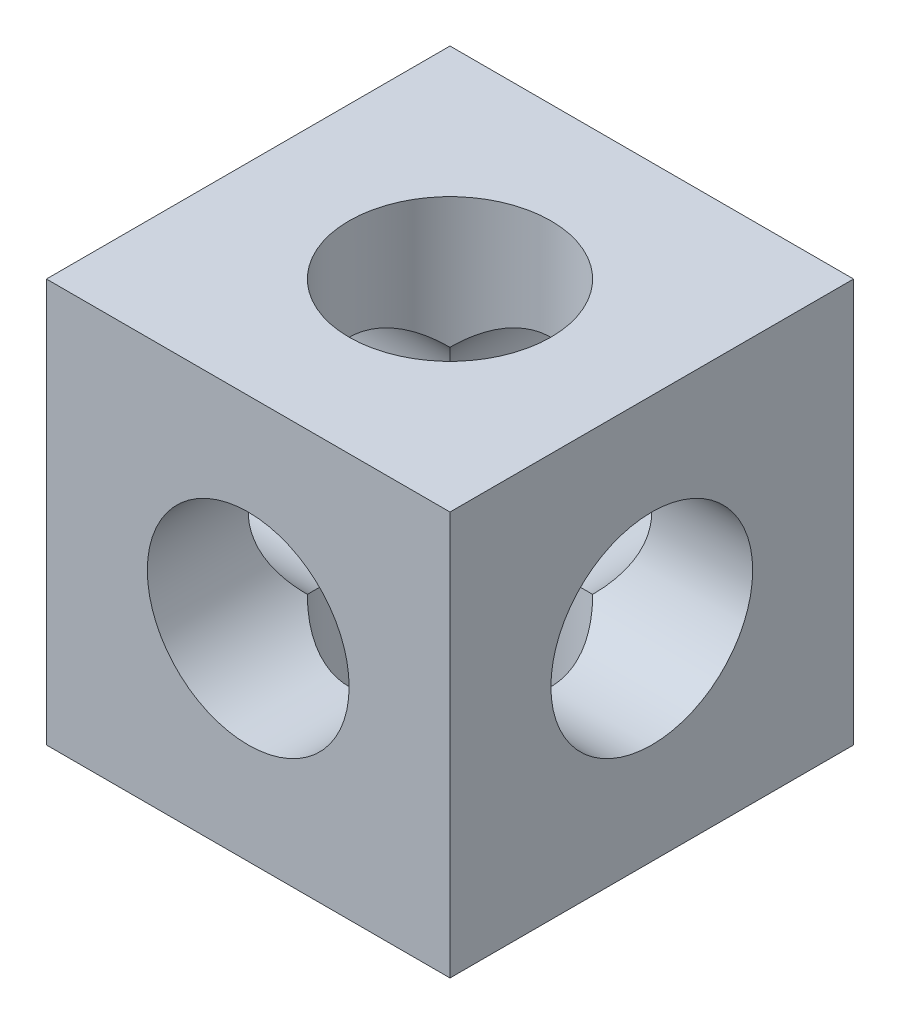
from build123d import *

# Parameters (mm, degrees)
SKETCH_1_W          = 6
SKETCH_1_H          = 6
EXTRUDE_1_DEPTH     = 6
SKETCH_2_R          = 1.5
CUT_EXTRUDE_1_DEPTH = 8.348469228
SKETCH_3_R          = 1.5
CUT_EXTRUDE_2_DEPTH = 10
SKETCH_4_R          = 1.5
CUT_EXTRUDE_3_DEPTH = 10


with BuildPart() as part:
    # 草图1 → 凸台-拉伸1 (new body)
    with BuildSketch(Plane.XY):
        Rectangle(SKETCH_1_W, SKETCH_1_H)
    extrude(amount=EXTRUDE_1_DEPTH)

    # 草图2 → 切除-拉伸1 (cut, through all)
    with BuildSketch(Plane.XY.offset(6)):
        Circle(SKETCH_2_R)
    extrude(amount=-CUT_EXTRUDE_1_DEPTH, mode=Mode.SUBTRACT)

    # 草图3 → 切除-拉伸2 (cut, through all)
    with BuildSketch(Plane(origin=(3, 0, 0), x_dir=(0, 0, -1), z_dir=(1, 0, 0))):
        with Locations((-3, 0)):
            Circle(SKETCH_3_R)
    extrude(amount=-CUT_EXTRUDE_2_DEPTH, mode=Mode.SUBTRACT)

    # 草图4 → 切除-拉伸3 (cut, through all)
    with BuildSketch(Plane(origin=(0, 3, 0), x_dir=(1, 0, 0), z_dir=(0, 1, 0))):
        with Locations((0, -3)):
            Circle(SKETCH_4_R)
    extrude(amount=-CUT_EXTRUDE_3_DEPTH, mode=Mode.SUBTRACT)


solid = part.part
